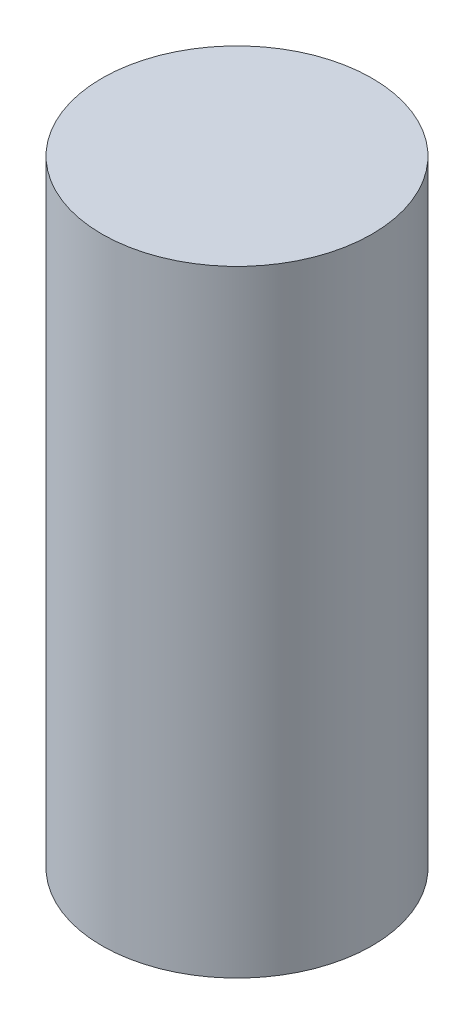
from build123d import *

# Parameters (mm, degrees)
SKETCH_1_R      = 13.585
EXTRUDE_1_DEPTH = 62


with BuildPart() as part:
    # 草图1 → 凸台-拉伸1 (new body)
    with BuildSketch(Plane(origin=(0, 0, 0), x_dir=(1, 0, 0), z_dir=(0, 1, 0))):
        Circle(SKETCH_1_R)
    extrude(amount=EXTRUDE_1_DEPTH)


solid = part.part
